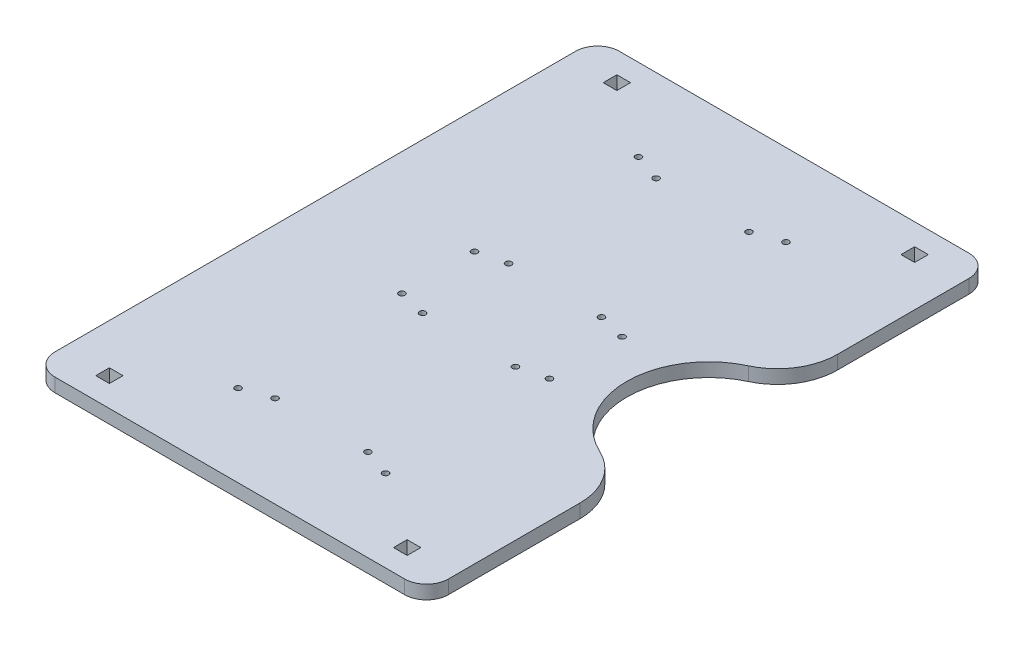
from build123d import *

# Parameters (mm, degrees)
SKETCH3_R           = 1.4224
SKETCH3_W           = 6.35
SKETCH3_H           = 6.35
BOSS_EXTRUDE1_DEPTH = 6.35
FILLET1_R           = 10.16
FILLET2_R           = 27.94


with BuildPart() as part:
    # Sketch3 → Boss-Extrude1 (new body)
    with BuildSketch(Plane(origin=(0, 0, 0), x_dir=(1, 0, 0), z_dir=(0, 1, 0))):
        with BuildLine():
            Line((182.88, 0), (0, 0))
            Line((0, 0), (0, 262.339276313))
            Line((0, 262.339276313), (182.88, 262.339276313))
            Line((182.88, 262.339276313), (182.88, 169.269638157))
            ThreePointArc((182.88, 169.269638157), (144.78, 131.169638157), (182.88, 93.069638157))
            Line((182.88, 93.069638157), (182.88, 0))
        make_face()
        with Locations((57.15, 38.1)):
            Circle(SKETCH3_R, mode=Mode.SUBTRACT)
        with Locations((57.15, 114.3)):
            Circle(SKETCH3_R, mode=Mode.SUBTRACT)
        with Locations((125.73, 114.3)):
            Circle(SKETCH3_R, mode=Mode.SUBTRACT)
        with Locations((125.73, 38.1)):
            Circle(SKETCH3_R, mode=Mode.SUBTRACT)
        with Locations((69.85, 151.157668748)):
            Circle(SKETCH3_R, mode=Mode.SUBTRACT)
        with Locations((69.85, 219.737668748)):
            Circle(SKETCH3_R, mode=Mode.SUBTRACT)
        with Locations((113.03, 151.157668748)):
            Circle(SKETCH3_R, mode=Mode.SUBTRACT)
        with Locations((113.03, 219.737668748)):
            Circle(SKETCH3_R, mode=Mode.SUBTRACT)
        with Locations((113.03, 42.601607565)):
            Circle(SKETCH3_R, mode=Mode.SUBTRACT)
        with Locations((113.03, 111.181607565)):
            Circle(SKETCH3_R, mode=Mode.SUBTRACT)
        with Locations((69.85, 111.181607565)):
            Circle(SKETCH3_R, mode=Mode.SUBTRACT)
        with Locations((69.85, 42.601607565)):
            Circle(SKETCH3_R, mode=Mode.SUBTRACT)
        with Locations((125.73, 148.039276313)):
            Circle(SKETCH3_R, mode=Mode.SUBTRACT)
        with Locations((125.73, 224.239276313)):
            Circle(SKETCH3_R, mode=Mode.SUBTRACT)
        with Locations((57.15, 224.239276313)):
            Circle(SKETCH3_R, mode=Mode.SUBTRACT)
        with Locations((57.15, 148.039276313)):
            Circle(SKETCH3_R, mode=Mode.SUBTRACT)
        with Locations((22.225, 13.212735966)):
            Rectangle(SKETCH3_W, SKETCH3_H, mode=Mode.SUBTRACT)
        with Locations((160.655, 13.212735966)):
            Rectangle(SKETCH3_W, SKETCH3_H, mode=Mode.SUBTRACT)
        with Locations((160.655, 249.126540348)):
            Rectangle(SKETCH3_W, SKETCH3_H, mode=Mode.SUBTRACT)
        with Locations((22.225, 249.126540348)):
            Rectangle(SKETCH3_W, SKETCH3_H, mode=Mode.SUBTRACT)
    extrude(amount=BOSS_EXTRUDE1_DEPTH)

    # Fillet1
    fillet1_edges = [part.edges().sort_by_distance(p)[0] for p in [
        (0, 3.175, 0),
        (0, 3.175, -262.339276313),
        (182.88, 3.175, -262.339276313),
        (182.88, 3.175, 0),
    ]]
    fillet(fillet1_edges, radius=FILLET1_R)

    # Fillet2
    fillet2_edges = [part.edges().sort_by_distance(p)[0] for p in [
        (182.88, 3.175, -169.269638157),
        (182.88, 3.175, -93.069638157),
    ]]
    fillet(fillet2_edges, radius=FILLET2_R)


solid = part.part
